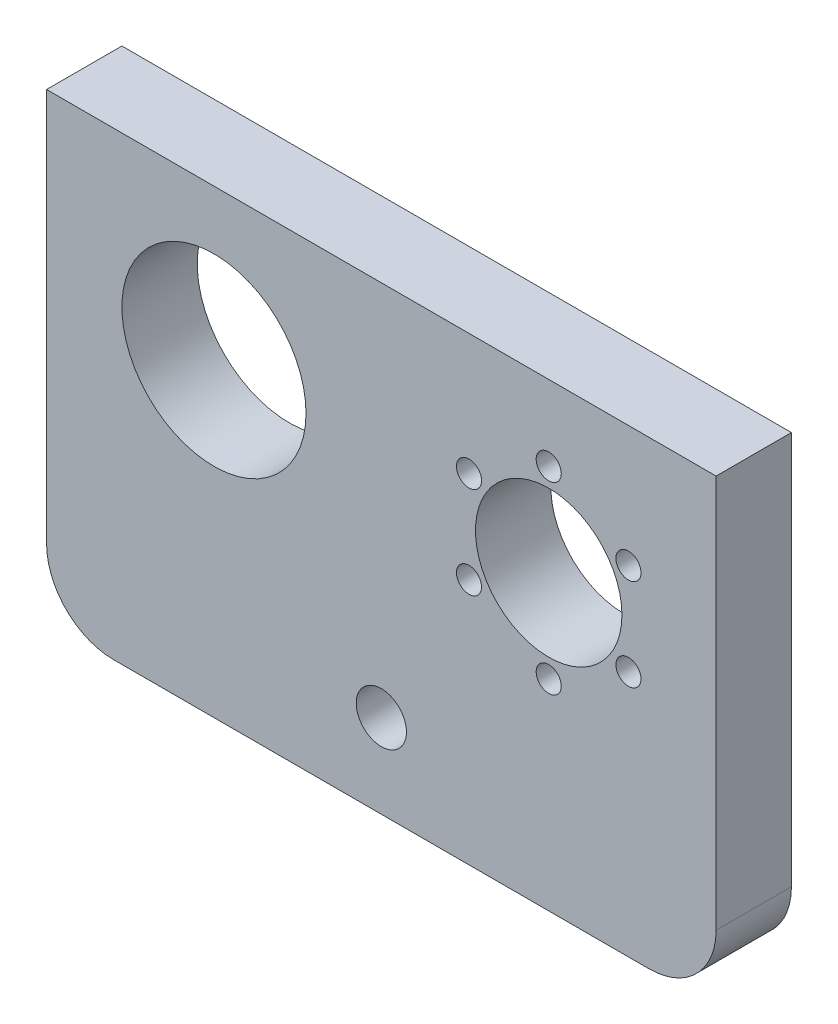
from build123d import *

# Parameters (mm, degrees)
ESQUISSE1_W             = 80
ESQUISSE1_H             = 55
BOSS_EXTRU_1_DEPTH      = 9
ESQUISSE2_R             = 11
ESQUISSE2_R_2           = 8.75
ESQUISSE2_R_3           = 1.5
ENL_V_MAT_EXTRU_1_DEPTH = 98.49871794
ESQUISSE3_R             = 3
ENL_V_MAT_EXTRU_2_DEPTH = 98.49871794
CONG_1_R                = 8


with BuildPart() as part:
    # Esquisse1 → Boss.-Extru.1 (new body)
    with BuildSketch(Plane.XY):
        with Locations((40, 27.5)):
            Rectangle(ESQUISSE1_W, ESQUISSE1_H)
    extrude(amount=BOSS_EXTRU_1_DEPTH)

    # Esquisse2 → Enlèv. mat.-Extru.1 (cut, through all)
    with BuildSketch(Plane.XY.offset(9)):
        with Locations((20, 37)):
            Circle(ESQUISSE2_R)
        with Locations((60, 35)):
            Circle(ESQUISSE2_R_2)
        with Locations((60, 46)):
            Circle(ESQUISSE2_R_3)
        with Locations((69.526279442, 40.5)):
            Circle(ESQUISSE2_R_3)
        with Locations((69.526279442, 29.5)):
            Circle(ESQUISSE2_R_3)
        with Locations((60, 24)):
            Circle(ESQUISSE2_R_3)
        with Locations((50.473720558, 29.5)):
            Circle(ESQUISSE2_R_3)
        with Locations((50.473720558, 40.5)):
            Circle(ESQUISSE2_R_3)
    extrude(amount=-ENL_V_MAT_EXTRU_1_DEPTH, mode=Mode.SUBTRACT)

    # Esquisse3 → Enlèv. mat.-Extru.2 (cut, through all)
    with BuildSketch(Plane.XY.offset(9)):
        with Locations((40, 10)):
            Circle(ESQUISSE3_R)
    extrude(amount=-ENL_V_MAT_EXTRU_2_DEPTH, mode=Mode.SUBTRACT)

    # Congé1
    cong_1_edges = [part.edges().sort_by_distance(p)[0] for p in [
        (0, 0, 4.5),
        (80, 0, 4.5),
    ]]
    fillet(cong_1_edges, radius=CONG_1_R)


solid = part.part
